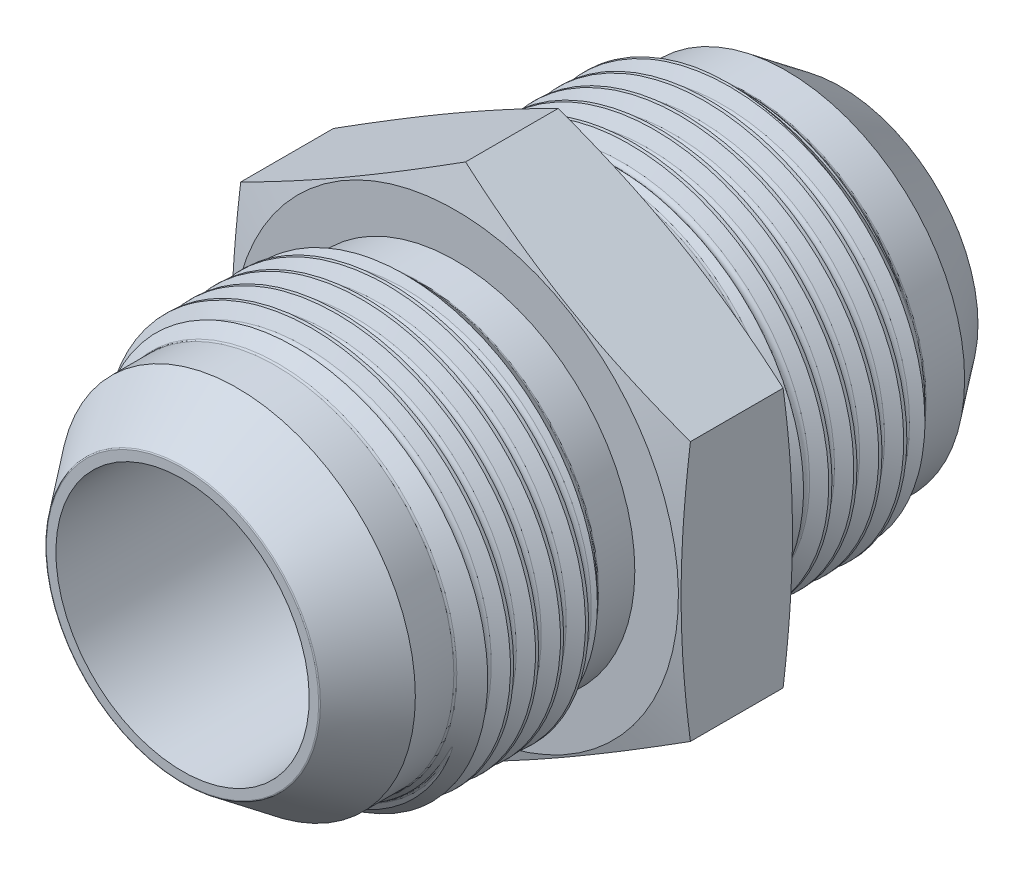
from build123d import *

# Parameters (mm, degrees)
CUT_SWEEP1_PITCH         = 2.1166666666666694
CIRPATTERN1_COUNT        = 2
CIRPATTERN1_ANGLE        = 180.0000000000004
BOSS_EXTRUDE1_DEPTH      = 4.7625
BOSS_EXTRUDE1_DEPTH_BACK = 4.7625
CIRPATTERN2_COUNT        = 2
CIRPATTERN2_ANGLE        = 180.0000000000004


with BuildPart() as part:
    # Sketch1 → Revolve1 (revolve)
    with BuildSketch(Plane(origin=(0, 0, 0), x_dir=(0, 0, -1), z_dir=(1, 0, 0)), mode=Mode.PRIVATE) as revolve1_sk:
        with BuildLine():
            Line((-27.9019, 0), (0, 0))
            Line((0, 0), (-8.7e-16, 15.1765))
            Line((-8.7e-16, 15.1765), (-7.8322897551572295, 15.1765))
            ThreePointArc((-7.8322897551572295, 15.1765), (-7.9294913469779615, 15.195834598742135), (-8.01189487757861, 15.250894877578618))
            Line((-8.01189487757861, 15.250894877578618), (-9.42975, 16.668750000000003))
            Line((-9.42975, 16.668750000000003), (-18.319750000000003, 16.668749999999996))
            Line((-18.319750000000003, 16.668749999999996), (-19.82650512242138, 15.161994877578616))
            ThreePointArc((-19.82650512242138, 15.161994877578616), (-19.908908653022035, 15.106934598742136), (-20.006110244842766, 15.087600000000002))
            Line((-20.006110244842766, 15.087600000000002), (-23.267195960490735, 15.0876))
            Line((-23.267195960490735, 15.0876), (-27.851330507940308, 11.633206845553225))
            ThreePointArc((-27.851330507940308, 11.633206845553225), (-27.888556663923456, 11.588447258042168), (-27.9019, 11.531780135777222))
            Line((-27.9019, 11.531780135777222), (-27.9019, 0))
        make_face()
    revolve(revolve1_sk.sketch.rotate(Axis((0, 0, 19.812), (0, 0, -1)), 90), axis=Axis((0, 0, 19.812), (0, 0, -1)))

    # Cut-Sweep1: the profile of Sketch3 screwed along a right-hand helix of 11.932 turns, 10 arcs to a turn; built about Z, then put on its axis
    cut_sweep1_z = Axis((0, 0, 0), (0, 0, 1))
    cut_sweep1_corners = [(16.783317944, 0, -1.918229167), (15.637638504, 0, -1.256770833), (15.44669193, 0, -0.926041667), (15.637638504, 0, -0.5953125), (16.783317944, 0, 0.066145833)]
    with BuildLine(mode=Mode.PRIVATE) as cut_sweep1_profile:
        Line(cut_sweep1_corners[0], cut_sweep1_corners[1])
        Line(cut_sweep1_corners[3], cut_sweep1_corners[4])
        Line(cut_sweep1_corners[4], cut_sweep1_corners[0])
        ThreePointArc((15.637638504, 0, -1.256770833), (15.49785591, 0, -1.11698824), (15.44669193, 0, -0.926041667))
        ThreePointArc((15.44669193, 0, -0.926041667), (15.49785591, 0, -0.735095093), (15.637638504, 0, -0.5953125))
    cut_sweep1_cap = Face(cut_sweep1_profile.wire())
    cut_sweep1_arcs = [((15.637638504, 0, -1.256770833), (15.44669193, 0, -1.146527778), (15.44669193, 0, -0.926041667), (1, 0.8660254037844384, 1)), ((15.44669193, 0, -0.926041667), (15.44669193, 0, -0.705555556), (15.637638504, 0, -0.5953125), (1, 0.8660254037844384, 1))]  # start, shoulder, end, weights
    cut_sweep1_turn_angles = [0, 18, 36, 54, 72, 90, 108, 126, 144, 162, 180, 198, 216, 234, 252, 270, 288, 306, 324, 342, 360]
    cut_sweep1_turn_weights = [1, 0.9510565162951535, 1, 0.9510565162951535, 1, 0.9510565162951535, 1, 0.9510565162951535, 1, 0.9510565162951535, 1, 0.9510565162951535, 1, 0.9510565162951535, 1, 0.9510565162951535, 1, 0.9510565162951535, 1, 0.9510565162951535, 1]
    cut_sweep1_turn_rails = [Edge.make_bspline([Vector(p[0], p[1], 0).rotate(cut_sweep1_z, cut_sweep1_turn_angles[k]) / cut_sweep1_turn_weights[k] + Vector(0, 0, p[2] + CUT_SWEEP1_PITCH * cut_sweep1_turn_angles[k] / 360) for k in range(21)], [0, 0, 0, 1, 1, 2, 2, 3, 3, 4, 4, 5, 5, 6, 6, 7, 7, 8, 8, 9, 9, 10, 10, 10], 2, cut_sweep1_turn_weights) for p in cut_sweep1_corners]
    cut_sweep1_turn_sides = [*[Face.make_surface_from_curves(cut_sweep1_turn_rails[p[0]], cut_sweep1_turn_rails[p[1]]) for p in [(0, 1), (3, 4), (4, 0)]], *[Face.make_bezier_surface([[Vector(p[j][0], p[j][1], 0).rotate(cut_sweep1_z, cut_sweep1_turn_angles[2 * i + k]) / cut_sweep1_turn_weights[2 * i + k] + Vector(0, 0, p[j][2] + CUT_SWEEP1_PITCH * cut_sweep1_turn_angles[2 * i + k] / 360) for k in range(3)] for j in range(3)], [[p[3][j] * cut_sweep1_turn_weights[2 * i + k] for k in range(3)] for j in range(3)]) for p in cut_sweep1_arcs for i in range(10)]]
    cut_sweep1_last_angles = [3960, 3978, 3996, 4014, 4032, 4050, 4068, 4086, 4104, 4122, 4140, 4158, 4176, 4194, 4212, 4230, 4248, 4266, 4284, 4289.76, 4295.52]
    cut_sweep1_last_weights = [1, 0.9510565162951535, 1, 0.9510565162951535, 1, 0.9510565162951535, 1, 0.9510565162951535, 1, 0.9510565162951535, 1, 0.9510565162951535, 1, 0.9510565162951535, 1, 0.9510565162951535, 1, 0.9510565162951535, 1, 0.9949510169812918, 1]
    cut_sweep1_last_rails = [Edge.make_bspline([Vector(p[0], p[1], 0).rotate(cut_sweep1_z, cut_sweep1_last_angles[k]) / cut_sweep1_last_weights[k] + Vector(0, 0, p[2] + CUT_SWEEP1_PITCH * cut_sweep1_last_angles[k] / 360) for k in range(21)], [0, 0, 0, 1, 1, 2, 2, 3, 3, 4, 4, 5, 5, 6, 6, 7, 7, 8, 8, 9, 9, 10, 10, 10], 2, cut_sweep1_last_weights) for p in cut_sweep1_corners]
    cut_sweep1_last_sides = [*[Face.make_surface_from_curves(cut_sweep1_last_rails[p[0]], cut_sweep1_last_rails[p[1]]) for p in [(0, 1), (3, 4), (4, 0)]], *[Face.make_bezier_surface([[Vector(p[j][0], p[j][1], 0).rotate(cut_sweep1_z, cut_sweep1_last_angles[2 * i + k]) / cut_sweep1_last_weights[2 * i + k] + Vector(0, 0, p[j][2] + CUT_SWEEP1_PITCH * cut_sweep1_last_angles[2 * i + k] / 360) for k in range(3)] for j in range(3)], [[p[3][j] * cut_sweep1_last_weights[2 * i + k] for k in range(3)] for j in range(3)]) for p in cut_sweep1_arcs for i in range(10)]]
    cut_sweep1 = Plane(origin=(0, 0, 27.901900000000005), x_dir=(-3.49e-15, 1, 0), z_dir=(0, 0, -1)) * Solid(Shell([*[p.moved(Location((0, 0, CUT_SWEEP1_PITCH * i))) for i in range(11) for p in cut_sweep1_turn_sides], *cut_sweep1_last_sides, cut_sweep1_cap, cut_sweep1_cap.rotate(cut_sweep1_z, 4295.52).moved(Location((0, 0, CUT_SWEEP1_PITCH * 4295.52 / 360)))]))
    add(cut_sweep1, mode=Mode.SUBTRACT)


with BuildPart() as cirpattern1_1:
    # CirPattern1: pattern copy
    add(part.part.rotate(Axis((-10.477500000000001, 0, 0), (1, 0, 0)), 1 * CIRPATTERN1_ANGLE / (CIRPATTERN1_COUNT - 1)))


with BuildPart() as part_1:
    add(part.part)

    add(cirpattern1_1.part)  # Boss-Extrude1 merges CirPattern1_1
    # Sketch4 → Boss-Extrude1 (add, two sides: drawn at the far end of the back side and taken through both)
    with BuildSketch(Plane.XY.offset(-BOSS_EXTRUDE1_DEPTH_BACK)):
        Polygon((0, 21.997045256124743), (-19.050000000000004, 10.998522628062373), (-19.050000000000004, -10.99852262806237), (-3.13e-15, -21.997045256124743), (19.049999999999997, -10.998522628062373), (19.050000000000008, 10.998522628062366), align=None)
    extrude(amount=BOSS_EXTRUDE1_DEPTH + BOSS_EXTRUDE1_DEPTH_BACK)

    # Sketch5 → Cut-Revolve1 (revolve, cut)
    with BuildSketch(Plane(origin=(0, 0, 0), x_dir=(0, 0, -1), z_dir=(1, 0, 0)), mode=Mode.PRIVATE) as cut_revolve1_sk:
        Polygon((-4.7624999999999975, 25.121890512249486), (4.762499999999999, 25.121890512249486), (4.762499999999999, 18.8722), (3.925200237149186, 21.997045256124746), (-3.9252002371491703, 21.997045256124743), (-4.7624999999999975, 18.8722), align=None)
    revolve(cut_revolve1_sk.sketch.rotate(Axis((0, -2e-16, 4.762499999999999), (0, 4e-17, -1)), 180), axis=Axis((0, -2e-16, 4.762499999999999), (0, 4e-17, -1)), mode=Mode.SUBTRACT)

    # Sketch6 → Cut-Revolve2 (revolve, cut)
    with BuildSketch(Plane(origin=(0, 0, 0), x_dir=(0, 0, -1), z_dir=(1, 0, 0)), mode=Mode.PRIVATE) as cut_revolve2_sk:
        with BuildLine():
            Line((-27.9019, 10.7315), (0, 10.7315))
            ThreePointArc((0, 10.7315), (7.588316422303436, 7.588316422303435), (10.7315, 7.1e-16))
            Line((10.7315, 7.1e-16), (-27.9019, -3.9e-15))
            Line((-27.9019, -3.9e-15), (-27.9019, 10.7315))
        make_face()
    cut_revolve2 = revolve(cut_revolve2_sk.sketch.rotate(Axis((0, 7.1e-16, -10.7315), (0, -1.2e-16, 1)), 48.186461252), axis=Axis((0, 7.1e-16, -10.7315), (0, -1.2e-16, 1)), mode=Mode.SUBTRACT)

    # CirPattern2: Cut-Revolve2 ×2 about axis
    cirpattern2_axis = Axis((-10.477500000000001, 0, 0), (1, 0, 0))
    for i in range(1, CIRPATTERN2_COUNT):
        add(cut_revolve2.rotate(cirpattern2_axis, i * CIRPATTERN2_ANGLE / (CIRPATTERN2_COUNT - 1)), mode=Mode.SUBTRACT)


solid = part_1.part
